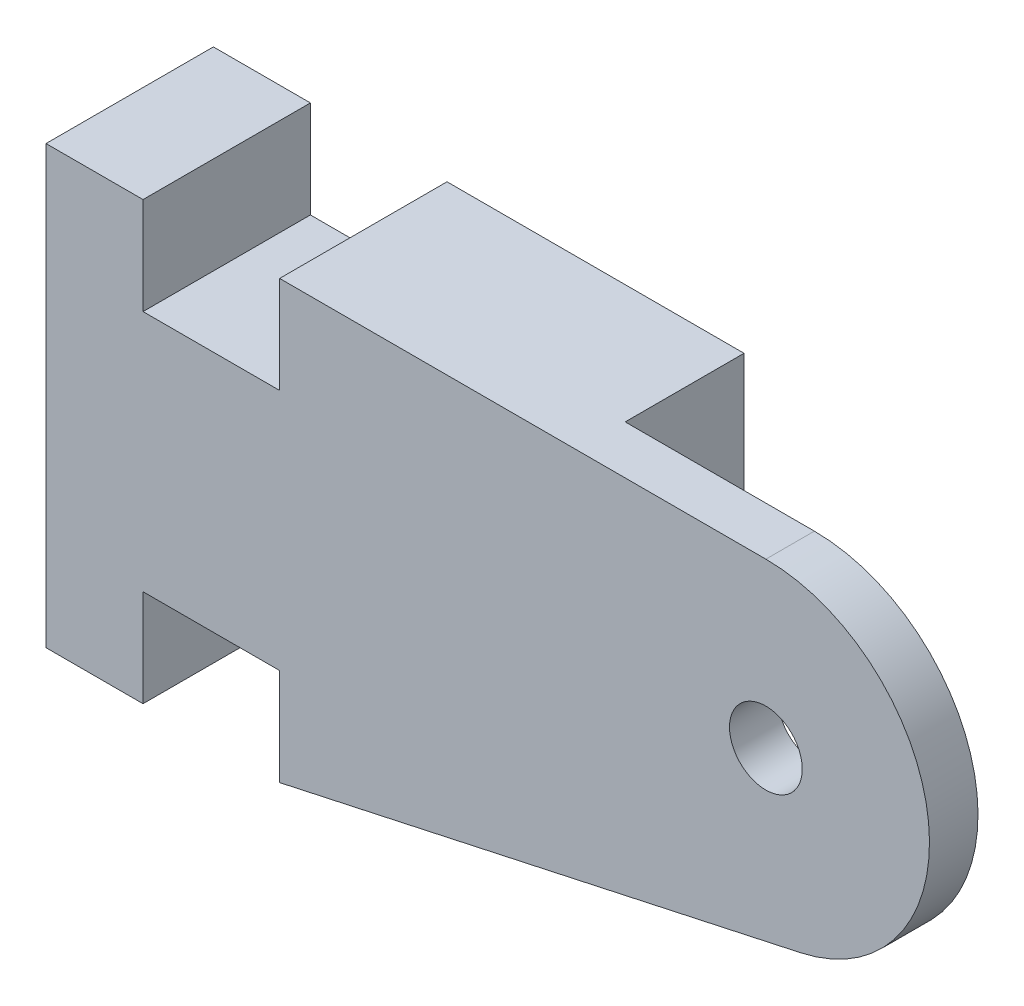
from build123d import *

# Parameters (mm, degrees)
SKETCH1_R           = 1.5
BOSS_EXTRUDE1_DEPTH = 6.9
CUT_EXTRUDE2_DEPTH  = 4.9
SKETCH5_R           = 1
CUT_EXTRUDE3_DEPTH  = 14
SKETCH8_R           = 1
CUT_EXTRUDE5_DEPTH  = 17


with BuildPart() as part:
    # Sketch1 → Boss-Extrude1 (new body)
    with BuildSketch(Plane.XY):
        with BuildLine():
            Line((9.631516349, 18.000341084), (29.676516349, 18.000341084))
            ThreePointArc((29.676516349, 18.000341084), (36.383041872, 11.97511352), (31.10792826, 4.663887347))
            Line((31.10792826, 4.663887347), (9.631516349, 0))
            Line((9.631516349, 0), (9.631516349, 4))
            Line((9.631516349, 4), (4, 4))
            Line((4, 4), (4, 0))
            Line((4, 0), (0, 0))
            Line((0, 0), (0, 18.000341084))
            Line((0, 18.000341084), (4, 18.000341084))
            Line((4, 18.000341084), (4, 14.000341084))
            Line((4, 14.000341084), (9.631516349, 14.000341084))
            Line((9.631516349, 14.000341084), (9.631516349, 18.000341084))
        make_face()
        with Locations((29.676516349, 11.255296941)):
            Circle(SKETCH1_R, mode=Mode.SUBTRACT)
    extrude(amount=BOSS_EXTRUDE1_DEPTH)

    # Sketch4 → Cut-Extrude2 (cut)
    with BuildSketch(Plane.XY):
        with BuildLine():
            Line((21.876472206, 2.659154375), (21.876472206, 18.000341084))
            Line((21.876472206, 18.000341084), (29.676516349, 18.000341084))
            ThreePointArc((29.676516349, 18.000341084), (36.383041872, 11.97511352), (31.10792826, 4.663887347))
            Line((31.10792826, 4.663887347), (31.10792826, 2.659154375))
            Line((31.10792826, 2.659154375), (21.876472206, 2.659154375))
        make_face()
    extrude(amount=CUT_EXTRUDE2_DEPTH, mode=Mode.SUBTRACT)

    # Sketch5 → Cut-Extrude3 (cut)
    with BuildSketch(Plane.ZY):
        with Locations((2.45, 8)):
            Circle(SKETCH5_R)
    extrude(amount=-CUT_EXTRUDE3_DEPTH, mode=Mode.SUBTRACT)

    # Sketch8 → Cut-Extrude5 (cut)
    with BuildSketch(Plane(origin=(19.746237848, -5.290988485, 0), x_dir=(0, 0, -1), z_dir=(0.9659258262890681, -0.25881904510252135, 0))):
        with Locations((-2.45, 11.2)):
            Circle(SKETCH8_R)
    extrude(amount=-CUT_EXTRUDE5_DEPTH, mode=Mode.SUBTRACT)


solid = part.part
